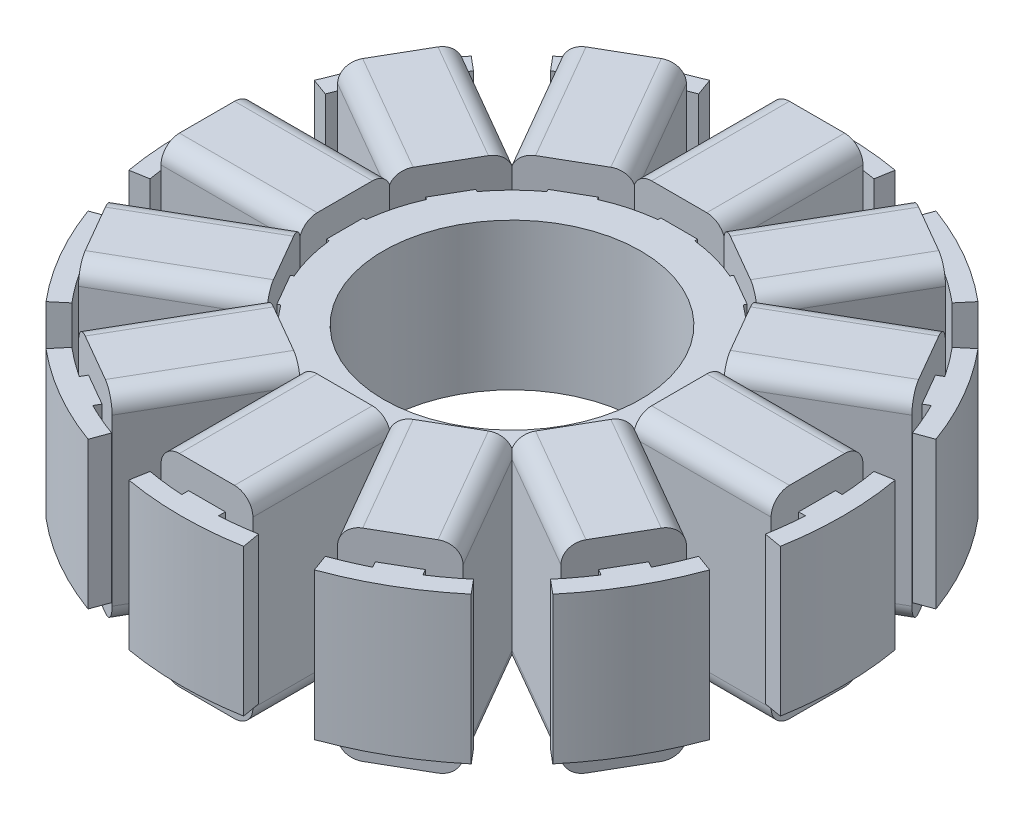
from build123d import *

# Parameters (mm, degrees)
SKETCH1_R           = 7
BOSS_EXTRUDE1_DEPTH = 8
BOSS_EXTRUDE4_DEPTH = 8
BOSS_EXTRUDE5_DEPTH = 7.5
CIRPATTERN2_COUNT   = 12
CIRPATTERN3_COUNT   = 12


with BuildPart() as part:
    # Sketch1 → Boss-Extrude1 (new body)
    with BuildSketch(Plane(origin=(0, 0, 0), x_dir=(1, 0, 0), z_dir=(0, 1, 0))):
        with BuildLine():
            ThreePointArc((1, 8.94427191), (0, 9), (-1, 8.94427191))
            ThreePointArc((-1, 8.94427191), (-6, -6.708203932), (9, 0))
            ThreePointArc((9, 0), (6.708203932, 6), (1, 8.94427191))
        make_face()
        Circle(SKETCH1_R, mode=Mode.SUBTRACT)
    extrude(amount=BOSS_EXTRUDE1_DEPTH)

    # Sketch1<3> → Boss-Extrude4 (add)
    with BuildSketch(Plane(origin=(0, 0, 0), x_dir=(1, 0, 0), z_dir=(0, 1, 0))):
        with BuildLine():
            Line((-1, 16.970562748), (-1, 8.94427191))
            ThreePointArc((-1, 8.94427191), (0, 9), (1, 8.94427191))
            Line((1, 8.94427191), (1, 16.970562748))
            ThreePointArc((1, 16.970562748), (1.979319197, 16.884380223), (2.95201902, 16.741731801))
            Line((2.95201902, 16.741731801), (3.125667198, 17.726539554))
            ThreePointArc((3.125667198, 17.726539554), (0, 18), (-3.125667198, 17.726539554))
            Line((-3.125667198, 17.726539554), (-2.95201902, 16.741731801))
            ThreePointArc((-2.95201902, 16.741731801), (-1.979319197, 16.884380223), (-1, 16.970562748))
        make_face()
    boss_extrude4 = extrude(amount=BOSS_EXTRUDE4_DEPTH)

    # Sketch2 → Boss-Extrude5 (add)
    with BuildSketch(Plane.XY.offset(-9.1)):
        with BuildLine():
            Line((-2.5, 8.5), (-2.5, -0.5))
            ThreePointArc((-2.5, -0.5), (-2.207106781, -1.207106781), (-1.5, -1.5))
            Line((-1.5, -1.5), (1.5, -1.5))
            ThreePointArc((1.5, -1.5), (2.207106781, -1.207106781), (2.5, -0.5))
            Line((2.5, -0.5), (2.5, 8.5))
            ThreePointArc((2.5, 8.5), (2.207106781, 9.207106781), (1.5, 9.5))
            Line((1.5, 9.5), (-1.5, 9.5))
            ThreePointArc((-1.5, 9.5), (-2.207106781, 9.207106781), (-2.5, 8.5))
        make_face()
    boss_extrude5 = extrude(amount=-BOSS_EXTRUDE5_DEPTH)

    # CirPattern2: Boss-Extrude4 ×12 about axis
    cirpattern2_axis = Axis((0, 8, 0), (0, -1, 0))
    for i in range(1, CIRPATTERN2_COUNT):
        add(boss_extrude4.rotate(cirpattern2_axis, i * 360 / CIRPATTERN2_COUNT))

    # CirPattern3: Boss-Extrude5 ×12 about axis
    cirpattern3_axis = Axis((0, 0, 0), (0, -1, 0))
    for i in range(1, CIRPATTERN3_COUNT):
        add(boss_extrude5.rotate(cirpattern3_axis, i * 360 / CIRPATTERN3_COUNT))


solid = part.part
